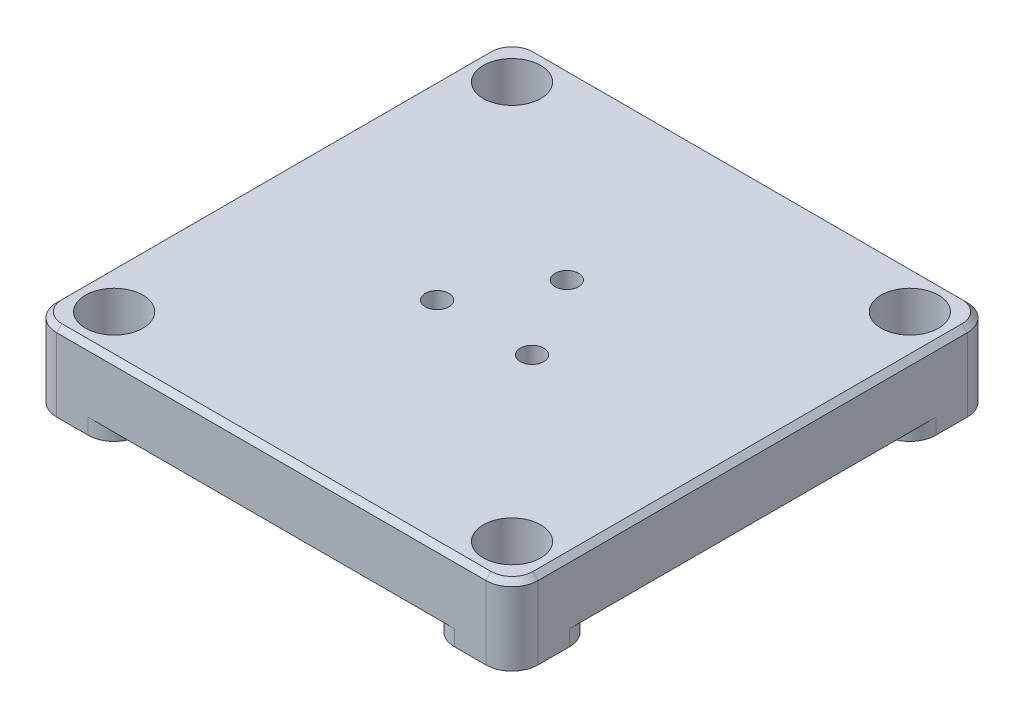
from build123d import *
from build123d.topology import SkipClean

# Parameters (mm, degrees)
SKETCH_1_W          = 92.2
SKETCH_1_H          = 92.2
SKETCH_1_R          = 2.25
SKETCH_1_R_2        = 3.5
EXTRUDE_1_DEPTH     = 12
SKETCH_2_R          = 3.6
CUT_EXTRUDE_1_DEPTH = 2
EXTRUDE_START       = 3
SKETCH_3_W          = 16
SKETCH_3_H          = 16
SKETCH_3_R          = 3.5
EXTRUDE_2_DEPTH     = 3
SKETCH_4_R          = 5.5
CUT_EXTRUDE_2_DEPTH = 10.8
FILLET_START        = -4
FILLET_1_DEPTH      = 17
FILLET_1_2_DEPTH    = 4
CHAMFER_1_SIZE      = 1


with BuildPart() as part:
    # Эскиз1 → Бобышка-Вытянуть1 (new body)
    with BuildSketch(Plane(origin=(0, 0, 0), x_dir=(1, 0, 0), z_dir=(0, 1, 0))):
        Rectangle(SKETCH_1_W, SKETCH_1_H)
        with Locations(Location((0, 10.5, 0), (0, 0, 270))):
            Circle(SKETCH_1_R, mode=Mode.SUBTRACT)
        with Locations(Location((-38.1, 38.1, 0), (0, 0, 270))):
            Circle(SKETCH_1_R_2, mode=Mode.SUBTRACT)
        with Locations(Location((38.1, 38.1, 0), (0, 0, 270))):
            Circle(SKETCH_1_R_2, mode=Mode.SUBTRACT)
        with Locations(Location((38.1, -38.1, 0), (0, 0, 270))):
            Circle(SKETCH_1_R_2, mode=Mode.SUBTRACT)
        with Locations(Location((-38.1, -38.1, 0), (0, 0, 270))):
            Circle(SKETCH_1_R_2, mode=Mode.SUBTRACT)
        with Locations(Location((9.09326674, -5.25, 0), (0, 0, 270))):
            Circle(SKETCH_1_R, mode=Mode.SUBTRACT)
        with Locations(Location((-9.09326674, -5.25, 0), (0, 0, 270))):
            Circle(SKETCH_1_R, mode=Mode.SUBTRACT)
    extrude(amount=EXTRUDE_1_DEPTH)

    # Эскиз2 → Вырез-Вытянуть1 (cut)
    with BuildSketch(Plane.XZ):
        with Locations(Location((-9.09326674, 5.25, 0), (0, 0, 270))):
            Circle(SKETCH_2_R)
        with Locations(Location((9.09326674, 5.25, 0), (0, 0, 270))):
            Circle(SKETCH_2_R)
        with Locations(Location((0, -10.5, 0), (0, 0, 270))):
            Circle(SKETCH_2_R)
    extrude(amount=-CUT_EXTRUDE_1_DEPTH, mode=Mode.SUBTRACT)

    # Эскиз3 → Бобышка-Вытянуть2 (add)
    # profile 1 of 4: a face of its own
    with SkipClean():  # the faces are left unmerged after this step: merging them gives an invalid solid
        with BuildSketch(Plane.XZ.offset(EXTRUDE_START)):
            with Locations((38.1, 38.1)):
                Rectangle(SKETCH_3_W, SKETCH_3_H)
            with Locations(Location((38.1, 38.1, 0), (0, 0, 270))):
                Circle(SKETCH_3_R, mode=Mode.SUBTRACT)
        # profile 2 of 4: a face of its own
        with BuildSketch(Plane.XZ.offset(EXTRUDE_START)):
            with Locations((-38.1, 38.1)):
                Rectangle(SKETCH_3_W, SKETCH_3_H)
            with Locations(Location((-38.1, 38.1, 0), (0, 0, 270))):
                Circle(SKETCH_3_R, mode=Mode.SUBTRACT)
        # profile 3 of 4: a face of its own
        with BuildSketch(Plane.XZ.offset(EXTRUDE_START)):
            with Locations((38.1, -38.1)):
                Rectangle(SKETCH_3_W, SKETCH_3_H)
            with Locations(Location((38.1, -38.1, 0), (0, 0, 270))):
                Circle(SKETCH_3_R, mode=Mode.SUBTRACT)
        # profile 4 of 4: a face of its own
        with BuildSketch(Plane.XZ.offset(EXTRUDE_START)):
            with Locations((-38.1, -38.1)):
                Rectangle(SKETCH_3_W, SKETCH_3_H)
            with Locations(Location((-38.1, -38.1, 0), (0, 0, 270))):
                Circle(SKETCH_3_R, mode=Mode.SUBTRACT)
        extrude(amount=-EXTRUDE_2_DEPTH)

    # Эскиз4 → Вырез-Вытянуть2 (cut)
    with BuildSketch(Plane(origin=(0, 12, 0), x_dir=(1, 0, 0), z_dir=(0, 1, 0))):
        with Locations(Location((38.1, 38.1, 0), (0, 0, 270))):
            Circle(SKETCH_4_R)
        with Locations(Location((38.1, -38.1, 0), (0, 0, 270))):
            Circle(SKETCH_4_R)
        with Locations(Location((-38.1, -38.1, 0), (0, 0, 270))):
            Circle(SKETCH_4_R)
        with Locations(Location((-38.1, 38.1, 0), (0, 0, 270))):
            Circle(SKETCH_4_R)
    extrude(amount=-CUT_EXTRUDE_2_DEPTH, mode=Mode.SUBTRACT)

    # Скругление1: read off the stored shape, not the designer's step
    # Скругление1 outline → Скругление1 (cut)
    with BuildSketch(Plane(origin=(0, 0, 0), x_dir=(1, 0, 0), z_dir=(0, 1, 0)).offset(FILLET_START)):
        with BuildLine():
            Line((-46.1, -46.1), (-41.1, -46.1))
            ThreePointArc((-41.1, -46.1), (-44.635533906, -44.635533906), (-46.1, -41.1))
            Line((-46.1, -41.1), (-46.1, -46.1))
        make_face()
        with BuildLine():
            ThreePointArc((46.1, -41.1), (44.635533906, -44.635533906), (41.1, -46.1))
            Line((41.1, -46.1), (46.1, -46.1))
            Line((46.1, -46.1), (46.1, -41.1))
        make_face()
        with BuildLine():
            Line((-46.1, 46.1), (-46.1, 41.1))
            ThreePointArc((-46.1, 41.1), (-44.635533906, 44.635533906), (-41.1, 46.1))
            Line((-41.1, 46.1), (-46.1, 46.1))
        make_face()
        with BuildLine():
            ThreePointArc((41.1, 46.1), (44.635533906, 44.635533906), (46.1, 41.1))
            Line((46.1, 41.1), (46.1, 46.1))
            Line((46.1, 46.1), (41.1, 46.1))
        make_face()
    extrude(amount=FILLET_1_DEPTH, mode=Mode.SUBTRACT)

    # Fillet 1 2 outline → Fillet 1 2 (cut)
    with BuildSketch(Plane(origin=(0, 0, 0), x_dir=(1, 0, 0), z_dir=(0, 1, 0)).offset(FILLET_START)):
        with BuildLine():
            ThreePointArc((-30.1, -41.1), (-31.564466094, -44.635533906), (-35.1, -46.1))
            Line((-35.1, -46.1), (-30.1, -46.1))
            Line((-30.1, -46.1), (-30.1, -41.1))
        make_face()
        with BuildLine():
            ThreePointArc((-35.1, -30.1), (-31.564466094, -31.564466094), (-30.1, -35.1))
            Line((-30.1, -35.1), (-30.1, -30.1))
            Line((-30.1, -30.1), (-35.1, -30.1))
        make_face()
        with BuildLine():
            Line((30.1, -41.1), (30.1, -46.1))
            Line((30.1, -46.1), (35.1, -46.1))
            ThreePointArc((35.1, -46.1), (31.564466094, -44.635533906), (30.1, -41.1))
        make_face()
        with BuildLine():
            Line((-46.1, -30.1), (-46.1, -35.1))
            ThreePointArc((-46.1, -35.1), (-44.635533906, -31.564466094), (-41.1, -30.1))
            Line((-41.1, -30.1), (-46.1, -30.1))
        make_face()
        with BuildLine():
            Line((30.1, -30.1), (30.1, -35.1))
            ThreePointArc((30.1, -35.1), (31.564466094, -31.564466094), (35.1, -30.1))
            Line((35.1, -30.1), (30.1, -30.1))
        make_face()
        with BuildLine():
            Line((-46.1, 35.1), (-46.1, 30.1))
            Line((-46.1, 30.1), (-41.1, 30.1))
            ThreePointArc((-41.1, 30.1), (-44.635533906, 31.564466094), (-46.1, 35.1))
        make_face()
        with BuildLine():
            Line((46.1, -30.1), (41.1, -30.1))
            ThreePointArc((41.1, -30.1), (44.635533906, -31.564466094), (46.1, -35.1))
            Line((46.1, -35.1), (46.1, -30.1))
        make_face()
        with BuildLine():
            ThreePointArc((-30.1, 35.1), (-31.564466094, 31.564466094), (-35.1, 30.1))
            Line((-35.1, 30.1), (-30.1, 30.1))
            Line((-30.1, 30.1), (-30.1, 35.1))
        make_face()
        with BuildLine():
            Line((41.1, 30.1), (46.1, 30.1))
            Line((46.1, 30.1), (46.1, 35.1))
            ThreePointArc((46.1, 35.1), (44.635533906, 31.564466094), (41.1, 30.1))
        make_face()
        with BuildLine():
            ThreePointArc((-35.1, 46.1), (-31.564466094, 44.635533906), (-30.1, 41.1))
            Line((-30.1, 41.1), (-30.1, 46.1))
            Line((-30.1, 46.1), (-35.1, 46.1))
        make_face()
        with BuildLine():
            Line((30.1, 30.1), (35.1, 30.1))
            ThreePointArc((35.1, 30.1), (31.564466094, 31.564466094), (30.1, 35.1))
            Line((30.1, 35.1), (30.1, 30.1))
        make_face()
        with BuildLine():
            Line((35.1, 46.1), (30.1, 46.1))
            Line((30.1, 46.1), (30.1, 41.1))
            ThreePointArc((30.1, 41.1), (31.564466094, 44.635533906), (35.1, 46.1))
        make_face()
    extrude(amount=FILLET_1_2_DEPTH, mode=Mode.SUBTRACT)

    # Фаска1
    chamfer_1_edges = [part.edges().sort_by_distance(p)[0] for p in [
        (0, 12, 46.1),
        (-46.1, 12, 0),
        (0, 12, -46.1),
        (46.1, 12, 0),
        (44.635533906, 12, 44.635533906),
        (-44.635533906, 12, 44.635533906),
        (44.635533906, 12, -44.635533906),
        (-44.635533906, 12, -44.635533906),
    ]]
    chamfer(chamfer_1_edges, length=CHAMFER_1_SIZE)


solid = part.part
